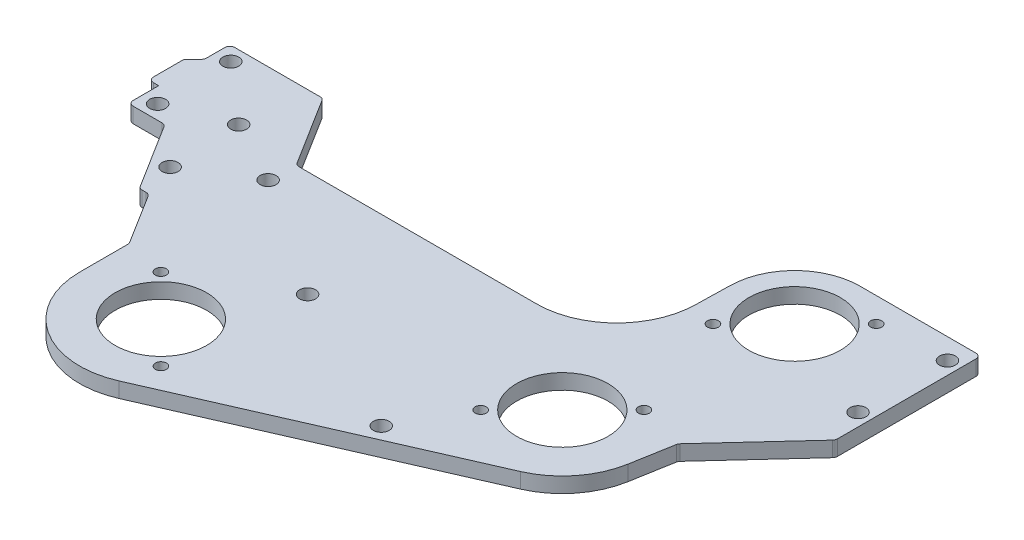
from build123d import *

# Parameters (mm, degrees)
SKETCH1_R                 = 14.29004
BOSS_EXTRUDE1_DEPTH       = 4.7625
F_10_CLEARANCE_HOLE1_D    = 4.9784
F_10_CLEARANCE_HOLE2_D    = 4.9784
TAP_DRILL_FOR_8_32_TAP1_D = 3.4544
F_10_CLEARANCE_HOLE3_D    = 4.9784
FILLET1_R                 = 1.5875


with BuildPart() as part:
    # Sketch1 → Boss-Extrude1 (new body)
    with BuildSketch(Plane(origin=(0, 0, 0), x_dir=(1, 0, 0), z_dir=(0, 1, 0))):
        with BuildLine():
            Line((-62.038222018, -79.883349745), (25.167081601, -41.695780276))
            ThreePointArc((25.167081601, -41.695780276), (34.91524479, -34.148496119), (39.940188099, -22.890693115))
            Line((39.940188099, -22.890693115), (42.275148896, -9.586739751))
            Line((42.275148896, -9.586739751), (65.831008632, 16.012754812))
            Line((65.831008632, 16.012754812), (65.831008632, 61.493591694))
            Line((65.831008632, 61.493591694), (28.046575186, 61.493591694))
            ThreePointArc((28.046575186, 61.493591694), (13.665119108, 55.581463016), (7.599980341, 41.263864189))
            Line((7.599980341, 41.263864189), (7.377499016, 31.276274442))
            ThreePointArc((7.377499016, 31.276274442), (0.022382465, 13.519452313), (-17.734439664, 6.164335762))
            Line((-17.734439664, 6.164335762), (-92.776174625, 6.164335762))
            Line((-92.776174625, 6.164335762), (-106.671272051, 28.401139958))
            Line((-106.671272051, 28.401139958), (-135.754553791, 28.401139958))
            Line((-135.754553791, 28.401139958), (-135.754553791, 20.45773786))
            Line((-135.754553791, 20.45773786), (-138.929553791, 17.28273786))
            Line((-138.929553791, 17.28273786), (-138.929553791, 6.164335762))
            Line((-138.929553791, 6.164335762), (-135.754553791, 6.164335762))
            Line((-135.754553791, 6.164335762), (-135.754553791, -3.360664238))
            Line((-135.754553791, -3.360664238), (-124.263208355, -3.360664238))
            Line((-124.263208355, -3.360664238), (-110.958501432, -24.652646126))
            Line((-110.958501432, -24.652646126), (-107.963388287, -24.652646126))
            Line((-107.963388287, -24.652646126), (-97.659911134, -41.141656383))
            Line((-97.659911134, -41.141656383), (-97.659911134, -56.628468385))
            ThreePointArc((-97.659911134, -56.628468385), (-86.144175153, -77.898718987), (-62.038222018, -79.883349745))
        make_face()
        with Locations((28.046575186, 41.045834415)):
            Circle(SKETCH1_R, mode=Mode.SUBTRACT)
        with Locations((15.031008632, -18.508482198)):
            Circle(SKETCH1_R, mode=Mode.SUBTRACT)
        with Locations((-72.258332946, -56.628468385)):
            Circle(SKETCH1_R, mode=Mode.SUBTRACT)
    extrude(amount=BOSS_EXTRUDE1_DEPTH)

    # #10 Clearance Hole1 (through all)
    with Locations(Plane(origin=(0, 4.7625, 0), x_dir=(1, 0, 0), z_dir=(0, 1, 0))):
        with Locations((61.830508632, 55.015834415), (61.830508632, 27.075834415), (-130.992053791, 23.944335762), (-130.992053791, 1.084335762)):
            Hole(F_10_CLEARANCE_HOLE1_D / 2)

    # #10 Clearance Hole2 (through all)
    with Locations(Plane(origin=(0, 4.7625, 0), x_dir=(1, 0, 0), z_dir=(0, 1, 0))):
        with Locations((-111.967153366, -14.051247514), (-93.119284429, -2.273791866), (-112.732400526, 8.143579493)):
            Hole(F_10_CLEARANCE_HOLE2_D / 2)

    # Tap Drill for #8-32 Tap1 (through all)
    with Locations(Plane(origin=(0, 4.7625, 0), x_dir=(1, 0, 0), z_dir=(0, 1, 0))):
        with Locations((-85.010296638, -43.876504694), (-59.506369254, -69.380432077), (2.27904494, -31.26044589), (27.782972324, -5.756518506), (15.294611495, 28.293870723), (40.798538878, 53.797798107)):
            Hole(TAP_DRILL_FOR_8_32_TAP1_D / 2)

    # #10 Clearance Hole3 (through all)
    with Locations(Plane(origin=(0, 4.7625, 0), x_dir=(1, 0, 0), z_dir=(0, 1, 0))):
        with Locations((-56.041369259, -27.019222928), (-8.951277081, -51.090630662)):
            Hole(F_10_CLEARANCE_HOLE3_D / 2)

    # Fillet1
    fillet1_edges = [part.edges().sort_by_distance(p)[0] for p in [
        (-135.754553791, 2.38125, 3.360664238),
        (-124.263208355, 2.38125, 3.360664238),
        (65.831008632, 2.38125, -61.493591694),
        (65.831008632, 2.38125, -16.012754812),
        (42.275148896, 2.38125, 9.586739751),
        (-97.659911134, 2.38125, 41.141656383),
        (-92.776174625, 2.38125, -6.164335762),
        (-106.671272051, 2.38125, -28.401139958),
        (-138.929553791, 2.38125, -17.28273786),
        (-107.963388287, 2.38125, 24.652646126),
        (-110.958501432, 2.38125, 24.652646126),
        (-135.754553791, 2.38125, -28.401139958),
        (-135.754553791, 2.38125, -20.45773786),
        (-138.929553791, 2.38125, -6.164335762),
    ]]
    fillet(fillet1_edges, radius=FILLET1_R)


solid = part.part
